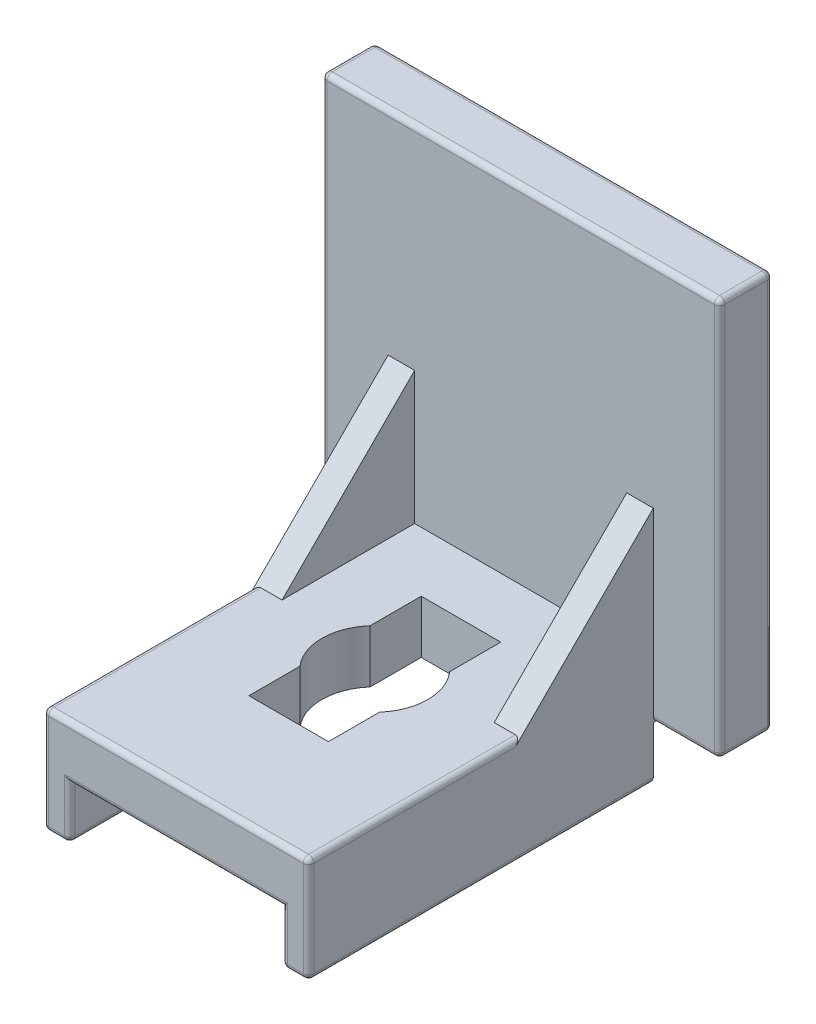
from build123d import *

# Parameters (mm, degrees)
SKETCH_1_W           = 15
SKETCH_1_H           = 15
EXTRUDE_1_DEPTH      = 2
EXTRUDE_2_DEPTH      = 2
SKETCH_3_W           = 1
SKETCH_3_H           = 13
EXTRUDE_3_DEPTH      = 2
CUT_EXTRUDE_1_REACH  = 24.5
EXTRUDE_START        = 4
EXTRUDE_4_DEPTH      = 1
EXTRUDE_START_2      = -4
EXTRUDE_5_DEPTH      = 1
SKETCH_6_W           = 3
SKETCH_6_H           = 3
EXTRUDE_6_DEPTH      = 1
EXTRUDE_7_DEPTH      = 1
EXTRUDE_7_DEPTH_BACK = 4
CUT_EXTRUDE_2_REACH  = 25.223
FILLET_1_R           = 0.1
FILLET_4_R           = 0.2
FILLET_5_R           = 0.2
FILLET_6_R           = 0.2


with BuildPart() as part:
    # 草图1 → 凸台-拉伸1 (new body)
    with BuildSketch(Plane.XY):
        with Locations((0, 7.5)):
            Rectangle(SKETCH_1_W, SKETCH_1_H)
    extrude(amount=EXTRUDE_1_DEPTH)

    # 草图2 → 凸台-拉伸2 (add)
    with BuildSketch(Plane(origin=(0, 0, 0), x_dir=(-1, 0, 0), z_dir=(0, -1, 0))):
        Polygon((-4, -2), (-5, -2), (-5, -15), (5, -15), (5, -2), (7.5, -2), (7.5, 0), (-4, 0), align=None)
    extrude(amount=-EXTRUDE_2_DEPTH)

    # 草图3 → 凸台-拉伸3 (add)
    with BuildSketch(Plane(origin=(0, 0, 0), x_dir=(-1, 0, 0), z_dir=(0, -1, 0))):
        with Locations((4.5, -8.5)):
            Rectangle(SKETCH_3_W, SKETCH_3_H)
        with Locations((-4.5, -8.5)):
            Rectangle(SKETCH_3_W, SKETCH_3_H)
    extrude(amount=EXTRUDE_3_DEPTH)

    # 草图4 → 切除-拉伸1 (cut, up to next)
    with BuildSketch(Plane(origin=(0, 0, 0), x_dir=(-1, 0, 0), z_dir=(0, -1, 0)), mode=Mode.PRIVATE) as cut_extrude_1_sk1:
        with BuildLine():
            Line((1.5, -8.822875656), (1.5, -10.75))
            Line((1.5, -10.75), (-1.5, -10.75))
            Line((-1.5, -10.75), (-1.5, -8.822875656))
            ThreePointArc((-1.5, -8.822875656), (-2, -7.5), (-1.5, -6.177124344))
            Line((-1.5, -6.177124344), (-1.5, -4.25))
            Line((-1.5, -4.25), (1.5, -4.25))
            Line((1.5, -4.25), (1.5, -6.177124344))
            ThreePointArc((1.5, -6.177124344), (2, -7.5), (1.5, -8.822875656))
        make_face()
    cut_extrude_1_tool1 = extrude(cut_extrude_1_sk1.sketch, amount=-CUT_EXTRUDE_1_REACH, mode=Mode.PRIVATE) & part.part
    add(cut_extrude_1_tool1.solids().sort_by_distance((0, 0, 7.5))[0], mode=Mode.SUBTRACT)

    # 草图5 → 凸台-拉伸4 (add)
    with BuildSketch(Plane(origin=(0, 0, 0), x_dir=(0, 0, -1), z_dir=(1, 0, 0)).offset(EXTRUDE_START)):
        Polygon((-2, 2), (-7, 2), (-2, 7), align=None)
    extrude(amount=EXTRUDE_4_DEPTH)

    # 草图5<2> → 凸台-拉伸5 (add)
    with BuildSketch(Plane(origin=(0, 0, 0), x_dir=(0, 0, -1), z_dir=(1, 0, 0)).offset(EXTRUDE_START_2)):
        Polygon((-2, 2), (-7, 2), (-2, 7), align=None)
    extrude(amount=-EXTRUDE_5_DEPTH)

    # 草图6 → 凸台-拉伸6 (add)
    with BuildSketch(Plane(origin=(0, 0, 0), x_dir=(-1, 0, 0), z_dir=(0, 0, -1))):
        with Locations((0, 7.5)):
            Rectangle(SKETCH_6_W, SKETCH_6_H)
    extrude(amount=EXTRUDE_6_DEPTH)

    # 草图7 → 凸台-拉伸7 (add, two sides: drawn at the far end of the back side and taken through both)
    with BuildSketch(Plane(origin=(0, 9, 0), x_dir=(1, 0, 0), z_dir=(0, 1, 0)).offset(-EXTRUDE_7_DEPTH_BACK)):
        with BuildLine():
            Line((-1.95, 2.5), (1.95, 2.5))
            Line((1.95, 2.5), (1.95, 1.555590279))
            ThreePointArc((1.95, 1.555590279), (1.780042303, 1.088161527), (1.5, 0.677124344))
            Line((1.5, 0.677124344), (-1.5, 0.677124344))
            ThreePointArc((-1.5, 0.677124344), (-1.780042303, 1.088161527), (-1.95, 1.555590279))
            Line((-1.95, 1.555590279), (-1.95, 2.5))
        make_face()
    extrude(amount=EXTRUDE_7_DEPTH + EXTRUDE_7_DEPTH_BACK)

    # 草图8 → 切除-拉伸2 (cut, up to next)
    with BuildSketch(Plane.ZY.offset(1.95), mode=Mode.PRIVATE) as cut_extrude_2_sk1:
        with BuildLine():
            Line((-2.5, 9.45), (-1.555590279, 9.45))
            ThreePointArc((-1.555590279, 9.45), (-1.088161527, 9.280042303), (-0.677124344, 9))
            Line((-0.677124344, 9), (-0.677124344, 10))
            Line((-0.677124344, 10), (-2.5, 10))
            Line((-2.5, 10), (-2.5, 9.45))
        make_face()
    cut_extrude_2_tool1 = extrude(cut_extrude_2_sk1.sketch, amount=-CUT_EXTRUDE_2_REACH, mode=Mode.PRIVATE) & part.part
    # 草图8 → 切除-拉伸2 (cut, up to next)
    with BuildSketch(Plane.ZY.offset(1.95), mode=Mode.PRIVATE) as cut_extrude_2_sk2:
        with BuildLine():
            Line((-2.5, 5.55), (-2.5, 5))
            Line((-2.5, 5), (-0.677124344, 5))
            Line((-0.677124344, 5), (-0.677124344, 6))
            ThreePointArc((-0.677124344, 6), (-1.088161527, 5.719957697), (-1.555590279, 5.55))
            Line((-1.555590279, 5.55), (-2.5, 5.55))
        make_face()
    cut_extrude_2_tool2 = extrude(cut_extrude_2_sk2.sketch, amount=-CUT_EXTRUDE_2_REACH, mode=Mode.PRIVATE) & part.part
    add(cut_extrude_2_tool1.solids().sort_by_distance((-1.95, 9.669375, -1.500125))[0], mode=Mode.SUBTRACT)
    add(cut_extrude_2_tool2.solids().sort_by_distance((-1.95, 5.330625, -1.500125))[0], mode=Mode.SUBTRACT)

    # 圆角1
    fillet_1_edges = [part.edges().sort_by_distance(p)[0] for p in [
        (0, 9.45, -2.5),
        (1.95, 7.5, -2.5),
        (-1.95, 7.5, -2.5),
        (0, 5.55, -2.5),
    ]]
    fillet(fillet_1_edges, radius=FILLET_1_R)

    # 圆角4
    fillet_4_edges = [part.edges().sort_by_distance(p)[0] for p in [
        (7.5, 7.5, 2),
        (0, 15, 2),
        (-7.5, 7.5, 2),
        (0, 15, 0),
        (7.5, 7.5, 0),
        (-7.5, 7.5, 0),
        (-7.5, 15, 1),
        (7.5, 15, 1),
        (7.5, 0, 1),
        (-7.5, 0, 1),
    ]]
    fillet(fillet_4_edges, radius=FILLET_4_R)

    # 圆角5
    # the kernel refuses this fillet: 0.2 mm, written as the material it takes off along each edge
    with BuildSketch(Plane(origin=(7.3, 0.2, 1.8), x_dir=(0, 0, 1), z_dir=(0, -1, 0))) as fillet_5_piece_1_section:
        Polygon((0, 0), (FILLET_5_R * 1.02, 0), (FILLET_5_R * 1.02, -FILLET_5_R * 1.02), (0, -FILLET_5_R * 1.02), align=None)
    fillet_5_piece_1 = extrude(amount=FILLET_5_R * 1.02, mode=Mode.PRIVATE)
    fillet_5_piece_1 = fillet_5_piece_1 - Plane(origin=(7.3, 0.2, 1.8), x_dir=(-0.7071067811865475, 0, -0.7071067811865475), z_dir=(0, -1, 0)) * Sphere(FILLET_5_R, mode=Mode.PRIVATE)
    add(fillet_5_piece_1, mode=Mode.SUBTRACT)
    with BuildSketch(Plane(origin=(7.3, 0.2, 0.2), x_dir=(0, -1, 0), z_dir=(0, 0, -1))) as fillet_5_piece_2_section:
        Polygon((0, 0), (FILLET_5_R * 1.02, 0), (FILLET_5_R * 1.02, -FILLET_5_R * 1.02), (0, -FILLET_5_R * 1.02), align=None)
    fillet_5_piece_2 = extrude(amount=FILLET_5_R * 1.02, mode=Mode.PRIVATE)
    fillet_5_piece_2 = fillet_5_piece_2 - Plane(origin=(7.3, 0.2, 0.2), x_dir=(-0.7071067811865475, 0.7071067811865475, 0), z_dir=(0, 0, -1)) * Sphere(FILLET_5_R, mode=Mode.PRIVATE)
    add(fillet_5_piece_2, mode=Mode.SUBTRACT)
    with BuildSketch(Plane(origin=(-7.3, 0.2, 1.8), x_dir=(0, 0, 1), z_dir=(0, -1, 0))) as fillet_5_piece_3_section:
        Polygon((0, 0), (FILLET_5_R * 1.02, 0), (FILLET_5_R * 1.02, FILLET_5_R * 1.02), (0, FILLET_5_R * 1.02), align=None)
    fillet_5_piece_3 = extrude(amount=FILLET_5_R * 1.02, mode=Mode.PRIVATE)
    fillet_5_piece_3 = fillet_5_piece_3 - Plane(origin=(-7.3, 0.2, 1.8), x_dir=(0.7071067811865475, 0, -0.7071067811865475), z_dir=(0, -1, 0)) * Sphere(FILLET_5_R, mode=Mode.PRIVATE)
    add(fillet_5_piece_3, mode=Mode.SUBTRACT)
    with BuildSketch(Plane(origin=(-7.3, 0.2, 0.2), x_dir=(0, -1, 0), z_dir=(0, 0, -1))) as fillet_5_piece_4_section:
        Polygon((0, 0), (FILLET_5_R * 1.02, 0), (FILLET_5_R * 1.02, FILLET_5_R * 1.02), (0, FILLET_5_R * 1.02), align=None)
    fillet_5_piece_4 = extrude(amount=FILLET_5_R * 1.02, mode=Mode.PRIVATE)
    fillet_5_piece_4 = fillet_5_piece_4 - Plane(origin=(-7.3, 0.2, 0.2), x_dir=(0.7071067811865475, 0.7071067811865475, 0), z_dir=(0, 0, -1)) * Sphere(FILLET_5_R, mode=Mode.PRIVATE)
    add(fillet_5_piece_4, mode=Mode.SUBTRACT)
    with BuildSketch(Plane(origin=(5, 0, 2), x_dir=(0, 0, -1), z_dir=(1, 0, 0))) as fillet_5_piece_5_section:
        with BuildLine():
            CenterArc((FILLET_5_R, FILLET_5_R), FILLET_5_R, 180, 90)
            Line((0, FILLET_5_R), (-FILLET_5_R * 0.02, FILLET_5_R))
            Line((-FILLET_5_R * 0.02, FILLET_5_R), (-FILLET_5_R * 0.02, -FILLET_5_R * 0.02))
            Line((-FILLET_5_R * 0.02, -FILLET_5_R * 0.02), (FILLET_5_R, -FILLET_5_R * 0.02))
            Line((FILLET_5_R, -FILLET_5_R * 0.02), (FILLET_5_R, 0))
        make_face()
    fillet_5_piece_5 = extrude(amount=2.3, mode=Mode.PRIVATE)
    fillet_5_piece_5 = split(fillet_5_piece_5, bisect_by=Plane(origin=(6.15, 0.040694626, 2), z_dir=(0, 0, -1)), keep=Keep.TOP, mode=Mode.PRIVATE)
    add(fillet_5_piece_5, mode=Mode.SUBTRACT)
    with BuildSketch(Plane(origin=(-7.3, 0, 0), x_dir=(0, 1, 0), z_dir=(1, 0, 0))) as fillet_5_piece_6:
        with BuildLine():
            CenterArc((FILLET_5_R, FILLET_5_R), FILLET_5_R, 180, 90)
            Line((0, FILLET_5_R), (-FILLET_5_R * 0.02, FILLET_5_R))
            Line((-FILLET_5_R * 0.02, FILLET_5_R), (-FILLET_5_R * 0.02, -FILLET_5_R * 0.02))
            Line((-FILLET_5_R * 0.02, -FILLET_5_R * 0.02), (FILLET_5_R, -FILLET_5_R * 0.02))
            Line((FILLET_5_R, -FILLET_5_R * 0.02), (FILLET_5_R, 0))
        make_face()
    extrude(amount=14.6, mode=Mode.SUBTRACT)
    with BuildSketch(Plane(origin=(-7.3, 0, 2), x_dir=(0, 0, -1), z_dir=(1, 0, 0))) as fillet_5_piece_7_section:
        with BuildLine():
            CenterArc((FILLET_5_R, FILLET_5_R), FILLET_5_R, 180, 90)
            Line((0, FILLET_5_R), (-FILLET_5_R * 0.02, FILLET_5_R))
            Line((-FILLET_5_R * 0.02, FILLET_5_R), (-FILLET_5_R * 0.02, -FILLET_5_R * 0.02))
            Line((-FILLET_5_R * 0.02, -FILLET_5_R * 0.02), (FILLET_5_R, -FILLET_5_R * 0.02))
            Line((FILLET_5_R, -FILLET_5_R * 0.02), (FILLET_5_R, 0))
        make_face()
    fillet_5_piece_7 = extrude(amount=2.3, mode=Mode.PRIVATE)
    fillet_5_piece_7 = split(fillet_5_piece_7, bisect_by=Plane(origin=(-6.15, 0.040694626, 2), z_dir=(0, 0, -1)), keep=Keep.TOP, mode=Mode.PRIVATE)
    add(fillet_5_piece_7, mode=Mode.SUBTRACT)
    with BuildSketch(Plane(origin=(5, 2, 15), x_dir=(0, -1, 0), z_dir=(-1, 0, 0))) as fillet_5_piece_8:
        with BuildLine():
            CenterArc((FILLET_5_R, -FILLET_5_R), FILLET_5_R, 90, 90)
            Line((0, -FILLET_5_R), (-FILLET_5_R * 0.02, -FILLET_5_R))
            Line((-FILLET_5_R * 0.02, -FILLET_5_R), (-FILLET_5_R * 0.02, FILLET_5_R * 0.02))
            Line((-FILLET_5_R * 0.02, FILLET_5_R * 0.02), (FILLET_5_R, FILLET_5_R * 0.02))
            Line((FILLET_5_R, FILLET_5_R * 0.02), (FILLET_5_R, 0))
        make_face()
    extrude(amount=10, mode=Mode.SUBTRACT)
    with BuildSketch(Plane(origin=(-5, 2, 15), x_dir=(1, 0, 0), z_dir=(0, -1, 0)), Plane(origin=(5, -2, 15), x_dir=(-1, 0, 0), z_dir=(0, 1, 0))) as fillet_5_piece_9:
        with BuildLine():
            CenterArc((FILLET_5_R, -FILLET_5_R), FILLET_5_R, 90, 90)
            Line((0, -FILLET_5_R), (-FILLET_5_R * 0.02, -FILLET_5_R))
            Line((-FILLET_5_R * 0.02, -FILLET_5_R), (-FILLET_5_R * 0.02, FILLET_5_R * 0.02))
            Line((-FILLET_5_R * 0.02, FILLET_5_R * 0.02), (FILLET_5_R, FILLET_5_R * 0.02))
            Line((FILLET_5_R, FILLET_5_R * 0.02), (FILLET_5_R, 0))
        make_face()
    extrude(amount=4, mode=Mode.SUBTRACT)
    with BuildSketch(Plane(origin=(-4, 0, 15), x_dir=(0, 0, -1), z_dir=(0, -1, 0))) as fillet_5_piece_10:
        with BuildLine():
            CenterArc((FILLET_5_R, -FILLET_5_R), FILLET_5_R, 90, 90)
            Line((0, -FILLET_5_R), (-FILLET_5_R * 0.02, -FILLET_5_R))
            Line((-FILLET_5_R * 0.02, -FILLET_5_R), (-FILLET_5_R * 0.02, FILLET_5_R * 0.02))
            Line((-FILLET_5_R * 0.02, FILLET_5_R * 0.02), (FILLET_5_R, FILLET_5_R * 0.02))
            Line((FILLET_5_R, FILLET_5_R * 0.02), (FILLET_5_R, 0))
        make_face()
    extrude(amount=2, mode=Mode.SUBTRACT)
    with BuildSketch(Plane(origin=(-4, -2, 15), x_dir=(0, 1, 0), z_dir=(-1, 0, 0))) as fillet_5_piece_11:
        with BuildLine():
            CenterArc((FILLET_5_R, FILLET_5_R), FILLET_5_R, 180, 90)
            Line((0, FILLET_5_R), (-FILLET_5_R * 0.02, FILLET_5_R))
            Line((-FILLET_5_R * 0.02, FILLET_5_R), (-FILLET_5_R * 0.02, -FILLET_5_R * 0.02))
            Line((-FILLET_5_R * 0.02, -FILLET_5_R * 0.02), (FILLET_5_R, -FILLET_5_R * 0.02))
            Line((FILLET_5_R, -FILLET_5_R * 0.02), (FILLET_5_R, 0))
        make_face()
    extrude(amount=1, mode=Mode.SUBTRACT)
    with BuildSketch(Plane(origin=(4, 0, 15), x_dir=(0, 0, -1), z_dir=(-1, 0, 0))) as fillet_5_piece_12:
        with BuildLine():
            CenterArc((FILLET_5_R, -FILLET_5_R), FILLET_5_R, 90, 90)
            Line((0, -FILLET_5_R), (-FILLET_5_R * 0.02, -FILLET_5_R))
            Line((-FILLET_5_R * 0.02, -FILLET_5_R), (-FILLET_5_R * 0.02, FILLET_5_R * 0.02))
            Line((-FILLET_5_R * 0.02, FILLET_5_R * 0.02), (FILLET_5_R, FILLET_5_R * 0.02))
            Line((FILLET_5_R, FILLET_5_R * 0.02), (FILLET_5_R, 0))
        make_face()
    extrude(amount=8, mode=Mode.SUBTRACT)
    with BuildSketch(Plane(origin=(4, 0, 15), x_dir=(0, 0, -1), z_dir=(0, -1, 0))) as fillet_5_piece_13:
        with BuildLine():
            CenterArc((FILLET_5_R, FILLET_5_R), FILLET_5_R, 180, 90)
            Line((0, FILLET_5_R), (-FILLET_5_R * 0.02, FILLET_5_R))
            Line((-FILLET_5_R * 0.02, FILLET_5_R), (-FILLET_5_R * 0.02, -FILLET_5_R * 0.02))
            Line((-FILLET_5_R * 0.02, -FILLET_5_R * 0.02), (FILLET_5_R, -FILLET_5_R * 0.02))
            Line((FILLET_5_R, -FILLET_5_R * 0.02), (FILLET_5_R, 0))
        make_face()
    extrude(amount=2, mode=Mode.SUBTRACT)
    with BuildSketch(Plane(origin=(4, -2, 15), x_dir=(0, 1, 0), z_dir=(1, 0, 0))) as fillet_5_piece_14:
        with BuildLine():
            CenterArc((FILLET_5_R, -FILLET_5_R), FILLET_5_R, 90, 90)
            Line((0, -FILLET_5_R), (-FILLET_5_R * 0.02, -FILLET_5_R))
            Line((-FILLET_5_R * 0.02, -FILLET_5_R), (-FILLET_5_R * 0.02, FILLET_5_R * 0.02))
            Line((-FILLET_5_R * 0.02, FILLET_5_R * 0.02), (FILLET_5_R, FILLET_5_R * 0.02))
            Line((FILLET_5_R, FILLET_5_R * 0.02), (FILLET_5_R, 0))
        make_face()
    extrude(amount=1, mode=Mode.SUBTRACT)
    with BuildSketch(Plane(origin=(5.5, 2, 15), x_dir=(0, -1, 0), z_dir=(-1, 0, 0))) as fillet_5_piece_15a_section:
        with BuildLine():
            CenterArc((FILLET_5_R, -FILLET_5_R), FILLET_5_R, 90, 90)
            Line((0, -FILLET_5_R), (-FILLET_5_R * 0.02, -FILLET_5_R))
            Line((-FILLET_5_R * 0.02, -FILLET_5_R), (-FILLET_5_R * 0.02, FILLET_5_R * 0.02))
            Line((-FILLET_5_R * 0.02, FILLET_5_R * 0.02), (FILLET_5_R, FILLET_5_R * 0.02))
            Line((FILLET_5_R, FILLET_5_R * 0.02), (FILLET_5_R, 0))
        make_face()
    fillet_5_piece_15a = extrude(amount=10.5, mode=Mode.PRIVATE)
    fillet_5_piece_15a = split(fillet_5_piece_15a, bisect_by=Plane(origin=(5, 1.954720977, 14.954720977), z_dir=(1, 0, 0)), keep=Keep.TOP, mode=Mode.PRIVATE)
    with BuildSketch(Plane(origin=(5, -2, 15), x_dir=(-1, 0, 0), z_dir=(0, 1, 0))) as fillet_5_piece_15b_section:
        with BuildLine():
            CenterArc((FILLET_5_R, -FILLET_5_R), FILLET_5_R, 90, 90)
            Line((0, -FILLET_5_R), (-FILLET_5_R * 0.02, -FILLET_5_R))
            Line((-FILLET_5_R * 0.02, -FILLET_5_R), (-FILLET_5_R * 0.02, FILLET_5_R * 0.02))
            Line((-FILLET_5_R * 0.02, FILLET_5_R * 0.02), (FILLET_5_R, FILLET_5_R * 0.02))
            Line((FILLET_5_R, FILLET_5_R * 0.02), (FILLET_5_R, 0))
        make_face()
    fillet_5_piece_15b = extrude(amount=4.5, mode=Mode.PRIVATE)
    fillet_5_piece_15b = split(fillet_5_piece_15b, bisect_by=Plane(origin=(4.954720977, 2, 14.954720977), z_dir=(0, 1, 0)), keep=Keep.TOP, mode=Mode.PRIVATE)
    fillet_5_piece_15 = fillet_5_piece_15a & fillet_5_piece_15b
    add(fillet_5_piece_15, mode=Mode.SUBTRACT)
    with BuildSketch(Plane(origin=(5, 2, 15), x_dir=(0, -1, 0), z_dir=(-1, 0, 0))) as fillet_5_piece_16a_section:
        with BuildLine():
            CenterArc((FILLET_5_R, -FILLET_5_R), FILLET_5_R, 90, 90)
            Line((0, -FILLET_5_R), (-FILLET_5_R * 0.02, -FILLET_5_R))
            Line((-FILLET_5_R * 0.02, -FILLET_5_R), (-FILLET_5_R * 0.02, FILLET_5_R * 0.02))
            Line((-FILLET_5_R * 0.02, FILLET_5_R * 0.02), (FILLET_5_R, FILLET_5_R * 0.02))
            Line((FILLET_5_R, FILLET_5_R * 0.02), (FILLET_5_R, 0))
        make_face()
    fillet_5_piece_16a = extrude(amount=10.5, mode=Mode.PRIVATE)
    fillet_5_piece_16a = split(fillet_5_piece_16a, bisect_by=Plane(origin=(-5, 1.954720977, 14.954720977), z_dir=(-1, 0, 0)), keep=Keep.TOP, mode=Mode.PRIVATE)
    with BuildSketch(Plane(origin=(-5, 2.5, 15), x_dir=(1, 0, 0), z_dir=(0, -1, 0))) as fillet_5_piece_16b_section:
        with BuildLine():
            CenterArc((FILLET_5_R, -FILLET_5_R), FILLET_5_R, 90, 90)
            Line((0, -FILLET_5_R), (-FILLET_5_R * 0.02, -FILLET_5_R))
            Line((-FILLET_5_R * 0.02, -FILLET_5_R), (-FILLET_5_R * 0.02, FILLET_5_R * 0.02))
            Line((-FILLET_5_R * 0.02, FILLET_5_R * 0.02), (FILLET_5_R, FILLET_5_R * 0.02))
            Line((FILLET_5_R, FILLET_5_R * 0.02), (FILLET_5_R, 0))
        make_face()
    fillet_5_piece_16b = extrude(amount=4.5, mode=Mode.PRIVATE)
    fillet_5_piece_16b = split(fillet_5_piece_16b, bisect_by=Plane(origin=(-4.954720977, 2, 14.954720977), z_dir=(0, 1, 0)), keep=Keep.TOP, mode=Mode.PRIVATE)
    fillet_5_piece_16 = fillet_5_piece_16a & fillet_5_piece_16b
    add(fillet_5_piece_16, mode=Mode.SUBTRACT)
    with BuildSketch(Plane(origin=(-5, 2, 15), x_dir=(1, 0, 0), z_dir=(0, -1, 0))) as fillet_5_piece_17a_section:
        with BuildLine():
            CenterArc((FILLET_5_R, -FILLET_5_R), FILLET_5_R, 90, 90)
            Line((0, -FILLET_5_R), (-FILLET_5_R * 0.02, -FILLET_5_R))
            Line((-FILLET_5_R * 0.02, -FILLET_5_R), (-FILLET_5_R * 0.02, FILLET_5_R * 0.02))
            Line((-FILLET_5_R * 0.02, FILLET_5_R * 0.02), (FILLET_5_R, FILLET_5_R * 0.02))
            Line((FILLET_5_R, FILLET_5_R * 0.02), (FILLET_5_R, 0))
        make_face()
    fillet_5_piece_17a = extrude(amount=4.5, mode=Mode.PRIVATE)
    fillet_5_piece_17a = split(fillet_5_piece_17a, bisect_by=Plane(origin=(-4.954720977, -2, 14.954720977), z_dir=(0, -1, 0)), keep=Keep.TOP, mode=Mode.PRIVATE)
    with BuildSketch(Plane(origin=(-4, -2, 15), x_dir=(0, 1, 0), z_dir=(-1, 0, 0))) as fillet_5_piece_17b_section:
        with BuildLine():
            CenterArc((FILLET_5_R, FILLET_5_R), FILLET_5_R, 180, 90)
            Line((0, FILLET_5_R), (-FILLET_5_R * 0.02, FILLET_5_R))
            Line((-FILLET_5_R * 0.02, FILLET_5_R), (-FILLET_5_R * 0.02, -FILLET_5_R * 0.02))
            Line((-FILLET_5_R * 0.02, -FILLET_5_R * 0.02), (FILLET_5_R, -FILLET_5_R * 0.02))
            Line((FILLET_5_R, -FILLET_5_R * 0.02), (FILLET_5_R, 0))
        make_face()
    fillet_5_piece_17b = extrude(amount=1.5, mode=Mode.PRIVATE)
    fillet_5_piece_17b = split(fillet_5_piece_17b, bisect_by=Plane(origin=(-5, -1.954720977, 14.954720977), z_dir=(-1, 0, 0)), keep=Keep.TOP, mode=Mode.PRIVATE)
    fillet_5_piece_17 = fillet_5_piece_17a & fillet_5_piece_17b
    add(fillet_5_piece_17, mode=Mode.SUBTRACT)
    with BuildSketch(Plane(origin=(4, -2, 15), x_dir=(0, 1, 0), z_dir=(1, 0, 0))) as fillet_5_piece_18a_section:
        with BuildLine():
            CenterArc((FILLET_5_R, -FILLET_5_R), FILLET_5_R, 90, 90)
            Line((0, -FILLET_5_R), (-FILLET_5_R * 0.02, -FILLET_5_R))
            Line((-FILLET_5_R * 0.02, -FILLET_5_R), (-FILLET_5_R * 0.02, FILLET_5_R * 0.02))
            Line((-FILLET_5_R * 0.02, FILLET_5_R * 0.02), (FILLET_5_R, FILLET_5_R * 0.02))
            Line((FILLET_5_R, FILLET_5_R * 0.02), (FILLET_5_R, 0))
        make_face()
    fillet_5_piece_18a = extrude(amount=1.5, mode=Mode.PRIVATE)
    fillet_5_piece_18a = split(fillet_5_piece_18a, bisect_by=Plane(origin=(5, -1.954720977, 14.954720977), z_dir=(1, 0, 0)), keep=Keep.TOP, mode=Mode.PRIVATE)
    with BuildSketch(Plane(origin=(5, -2.5, 15), x_dir=(-1, 0, 0), z_dir=(0, 1, 0))) as fillet_5_piece_18b_section:
        with BuildLine():
            CenterArc((FILLET_5_R, -FILLET_5_R), FILLET_5_R, 90, 90)
            Line((0, -FILLET_5_R), (-FILLET_5_R * 0.02, -FILLET_5_R))
            Line((-FILLET_5_R * 0.02, -FILLET_5_R), (-FILLET_5_R * 0.02, FILLET_5_R * 0.02))
            Line((-FILLET_5_R * 0.02, FILLET_5_R * 0.02), (FILLET_5_R, FILLET_5_R * 0.02))
            Line((FILLET_5_R, FILLET_5_R * 0.02), (FILLET_5_R, 0))
        make_face()
    fillet_5_piece_18b = extrude(amount=4.5, mode=Mode.PRIVATE)
    fillet_5_piece_18b = split(fillet_5_piece_18b, bisect_by=Plane(origin=(4.954720977, -2, 14.954720977), z_dir=(0, -1, 0)), keep=Keep.TOP, mode=Mode.PRIVATE)
    fillet_5_piece_18 = fillet_5_piece_18a & fillet_5_piece_18b
    add(fillet_5_piece_18, mode=Mode.SUBTRACT)
    with BuildSketch(Plane(origin=(4, 0, 15), x_dir=(0, 0, -1), z_dir=(-1, 0, 0))) as fillet_5_piece_19a_section:
        with BuildLine():
            CenterArc((FILLET_5_R, -FILLET_5_R), FILLET_5_R, 90, 90)
            Line((0, -FILLET_5_R), (-FILLET_5_R * 0.02, -FILLET_5_R))
            Line((-FILLET_5_R * 0.02, -FILLET_5_R), (-FILLET_5_R * 0.02, FILLET_5_R * 0.02))
            Line((-FILLET_5_R * 0.02, FILLET_5_R * 0.02), (FILLET_5_R, FILLET_5_R * 0.02))
            Line((FILLET_5_R, FILLET_5_R * 0.02), (FILLET_5_R, 0))
        make_face()
    fillet_5_piece_19a = extrude(amount=8.5, mode=Mode.PRIVATE)
    fillet_5_piece_19a = split(fillet_5_piece_19a, bisect_by=Plane(origin=(-4, 0.045279023, 14.954720977), z_dir=(-1, 0, 0)), keep=Keep.TOP, mode=Mode.PRIVATE)
    with BuildSketch(Plane(origin=(-4, 0.5, 15), x_dir=(0, 0, -1), z_dir=(0, -1, 0))) as fillet_5_piece_19b_section:
        with BuildLine():
            CenterArc((FILLET_5_R, -FILLET_5_R), FILLET_5_R, 90, 90)
            Line((0, -FILLET_5_R), (-FILLET_5_R * 0.02, -FILLET_5_R))
            Line((-FILLET_5_R * 0.02, -FILLET_5_R), (-FILLET_5_R * 0.02, FILLET_5_R * 0.02))
            Line((-FILLET_5_R * 0.02, FILLET_5_R * 0.02), (FILLET_5_R, FILLET_5_R * 0.02))
            Line((FILLET_5_R, FILLET_5_R * 0.02), (FILLET_5_R, 0))
        make_face()
    fillet_5_piece_19b = extrude(amount=2.5, mode=Mode.PRIVATE)
    fillet_5_piece_19b = split(fillet_5_piece_19b, bisect_by=Plane(origin=(-4.045279023, 0, 14.954720977), z_dir=(0, 1, 0)), keep=Keep.TOP, mode=Mode.PRIVATE)
    fillet_5_piece_19 = fillet_5_piece_19a & fillet_5_piece_19b
    add(fillet_5_piece_19, mode=Mode.SUBTRACT)
    with BuildSketch(Plane(origin=(-4, 0, 15), x_dir=(0, 0, -1), z_dir=(0, -1, 0))) as fillet_5_piece_20a_section:
        with BuildLine():
            CenterArc((FILLET_5_R, -FILLET_5_R), FILLET_5_R, 90, 90)
            Line((0, -FILLET_5_R), (-FILLET_5_R * 0.02, -FILLET_5_R))
            Line((-FILLET_5_R * 0.02, -FILLET_5_R), (-FILLET_5_R * 0.02, FILLET_5_R * 0.02))
            Line((-FILLET_5_R * 0.02, FILLET_5_R * 0.02), (FILLET_5_R, FILLET_5_R * 0.02))
            Line((FILLET_5_R, FILLET_5_R * 0.02), (FILLET_5_R, 0))
        make_face()
    fillet_5_piece_20a = extrude(amount=2.5, mode=Mode.PRIVATE)
    fillet_5_piece_20a = split(fillet_5_piece_20a, bisect_by=Plane(origin=(-4.045279023, -2, 14.954720977), z_dir=(0, -1, 0)), keep=Keep.TOP, mode=Mode.PRIVATE)
    with BuildSketch(Plane(origin=(-3.5, -2, 15), x_dir=(0, 1, 0), z_dir=(-1, 0, 0))) as fillet_5_piece_20b_section:
        with BuildLine():
            CenterArc((FILLET_5_R, FILLET_5_R), FILLET_5_R, 180, 90)
            Line((0, FILLET_5_R), (-FILLET_5_R * 0.02, FILLET_5_R))
            Line((-FILLET_5_R * 0.02, FILLET_5_R), (-FILLET_5_R * 0.02, -FILLET_5_R * 0.02))
            Line((-FILLET_5_R * 0.02, -FILLET_5_R * 0.02), (FILLET_5_R, -FILLET_5_R * 0.02))
            Line((FILLET_5_R, -FILLET_5_R * 0.02), (FILLET_5_R, 0))
        make_face()
    fillet_5_piece_20b = extrude(amount=1.5, mode=Mode.PRIVATE)
    fillet_5_piece_20b = split(fillet_5_piece_20b, bisect_by=Plane(origin=(-4, -1.954720977, 14.954720977), z_dir=(1, 0, 0)), keep=Keep.TOP, mode=Mode.PRIVATE)
    fillet_5_piece_20 = fillet_5_piece_20a & fillet_5_piece_20b
    add(fillet_5_piece_20, mode=Mode.SUBTRACT)
    with BuildSketch(Plane(origin=(4.5, 0, 15), x_dir=(0, 0, -1), z_dir=(-1, 0, 0))) as fillet_5_piece_21a_section:
        with BuildLine():
            CenterArc((FILLET_5_R, -FILLET_5_R), FILLET_5_R, 90, 90)
            Line((0, -FILLET_5_R), (-FILLET_5_R * 0.02, -FILLET_5_R))
            Line((-FILLET_5_R * 0.02, -FILLET_5_R), (-FILLET_5_R * 0.02, FILLET_5_R * 0.02))
            Line((-FILLET_5_R * 0.02, FILLET_5_R * 0.02), (FILLET_5_R, FILLET_5_R * 0.02))
            Line((FILLET_5_R, FILLET_5_R * 0.02), (FILLET_5_R, 0))
        make_face()
    fillet_5_piece_21a = extrude(amount=8.5, mode=Mode.PRIVATE)
    fillet_5_piece_21a = split(fillet_5_piece_21a, bisect_by=Plane(origin=(4, 0.045279023, 14.954720977), z_dir=(1, 0, 0)), keep=Keep.TOP, mode=Mode.PRIVATE)
    with BuildSketch(Plane(origin=(4, 0.5, 15), x_dir=(0, 0, -1), z_dir=(0, -1, 0))) as fillet_5_piece_21b_section:
        with BuildLine():
            CenterArc((FILLET_5_R, FILLET_5_R), FILLET_5_R, 180, 90)
            Line((0, FILLET_5_R), (-FILLET_5_R * 0.02, FILLET_5_R))
            Line((-FILLET_5_R * 0.02, FILLET_5_R), (-FILLET_5_R * 0.02, -FILLET_5_R * 0.02))
            Line((-FILLET_5_R * 0.02, -FILLET_5_R * 0.02), (FILLET_5_R, -FILLET_5_R * 0.02))
            Line((FILLET_5_R, -FILLET_5_R * 0.02), (FILLET_5_R, 0))
        make_face()
    fillet_5_piece_21b = extrude(amount=2.5, mode=Mode.PRIVATE)
    fillet_5_piece_21b = split(fillet_5_piece_21b, bisect_by=Plane(origin=(4.045279023, 0, 14.954720977), z_dir=(0, 1, 0)), keep=Keep.TOP, mode=Mode.PRIVATE)
    fillet_5_piece_21 = fillet_5_piece_21a & fillet_5_piece_21b
    add(fillet_5_piece_21, mode=Mode.SUBTRACT)
    with BuildSketch(Plane(origin=(4, 0, 15), x_dir=(0, 0, -1), z_dir=(0, -1, 0))) as fillet_5_piece_22a_section:
        with BuildLine():
            CenterArc((FILLET_5_R, FILLET_5_R), FILLET_5_R, 180, 90)
            Line((0, FILLET_5_R), (-FILLET_5_R * 0.02, FILLET_5_R))
            Line((-FILLET_5_R * 0.02, FILLET_5_R), (-FILLET_5_R * 0.02, -FILLET_5_R * 0.02))
            Line((-FILLET_5_R * 0.02, -FILLET_5_R * 0.02), (FILLET_5_R, -FILLET_5_R * 0.02))
            Line((FILLET_5_R, -FILLET_5_R * 0.02), (FILLET_5_R, 0))
        make_face()
    fillet_5_piece_22a = extrude(amount=2.5, mode=Mode.PRIVATE)
    fillet_5_piece_22a = split(fillet_5_piece_22a, bisect_by=Plane(origin=(4.045279023, -2, 14.954720977), z_dir=(0, -1, 0)), keep=Keep.TOP, mode=Mode.PRIVATE)
    with BuildSketch(Plane(origin=(3.5, -2, 15), x_dir=(0, 1, 0), z_dir=(1, 0, 0))) as fillet_5_piece_22b_section:
        with BuildLine():
            CenterArc((FILLET_5_R, -FILLET_5_R), FILLET_5_R, 90, 90)
            Line((0, -FILLET_5_R), (-FILLET_5_R * 0.02, -FILLET_5_R))
            Line((-FILLET_5_R * 0.02, -FILLET_5_R), (-FILLET_5_R * 0.02, FILLET_5_R * 0.02))
            Line((-FILLET_5_R * 0.02, FILLET_5_R * 0.02), (FILLET_5_R, FILLET_5_R * 0.02))
            Line((FILLET_5_R, FILLET_5_R * 0.02), (FILLET_5_R, 0))
        make_face()
    fillet_5_piece_22b = extrude(amount=1.5, mode=Mode.PRIVATE)
    fillet_5_piece_22b = split(fillet_5_piece_22b, bisect_by=Plane(origin=(4, -1.954720977, 14.954720977), z_dir=(-1, 0, 0)), keep=Keep.TOP, mode=Mode.PRIVATE)
    fillet_5_piece_22 = fillet_5_piece_22a & fillet_5_piece_22b
    add(fillet_5_piece_22, mode=Mode.SUBTRACT)

    # 圆角6
    # the kernel refuses this fillet: 0.2 mm, written as the material it takes off along each edge
    with BuildSketch(Plane(origin=(4.8, 1.8, 14.8), x_dir=(0, 1, 0), z_dir=(1, 0, 0))) as fillet_6_piece_1_section:
        Polygon((0, 0), (FILLET_6_R, 0), (FILLET_6_R, FILLET_6_R), (0, FILLET_6_R), align=None)
    fillet_6_piece_1 = extrude(amount=FILLET_6_R, mode=Mode.PRIVATE)
    fillet_6_piece_1 = fillet_6_piece_1 - Plane(origin=(4.8, 1.8, 14.8), x_dir=(0, -0.7071067811865475, -0.7071067811865475), z_dir=(1, 0, 0)) * Sphere(FILLET_6_R, mode=Mode.PRIVATE)
    add(fillet_6_piece_1, mode=Mode.SUBTRACT)
    with BuildSketch(Plane(origin=(4.8, -1.8, 14.8), x_dir=(0, -1, 0), z_dir=(1, 0, 0))) as fillet_6_piece_2_section:
        Polygon((0, 0), (FILLET_6_R, 0), (FILLET_6_R, -FILLET_6_R), (0, -FILLET_6_R), align=None)
    fillet_6_piece_2 = extrude(amount=FILLET_6_R, mode=Mode.PRIVATE)
    fillet_6_piece_2 = fillet_6_piece_2 - Plane(origin=(4.8, -1.8, 14.8), x_dir=(0, 0.7071067811865475, -0.7071067811865475), z_dir=(1, 0, 0)) * Sphere(FILLET_6_R, mode=Mode.PRIVATE)
    add(fillet_6_piece_2, mode=Mode.SUBTRACT)
    with BuildSketch(Plane(origin=(-4.8, 1.8, 14.8), x_dir=(0, 1, 0), z_dir=(-1, 0, 0))) as fillet_6_piece_3_section:
        Polygon((0, 0), (FILLET_6_R, 0), (FILLET_6_R, -FILLET_6_R), (0, -FILLET_6_R), align=None)
    fillet_6_piece_3 = extrude(amount=FILLET_6_R, mode=Mode.PRIVATE)
    fillet_6_piece_3 = fillet_6_piece_3 - Plane(origin=(-4.8, 1.8, 14.8), x_dir=(0, -0.7071067811865475, -0.7071067811865475), z_dir=(-1, 0, 0)) * Sphere(FILLET_6_R, mode=Mode.PRIVATE)
    add(fillet_6_piece_3, mode=Mode.SUBTRACT)
    with BuildSketch(Plane(origin=(4.2, -1.8, 14.8), x_dir=(-1, 0, 0), z_dir=(0, -1, 0))) as fillet_6_piece_4_section:
        Polygon((0, 0), (FILLET_6_R, 0), (FILLET_6_R, -FILLET_6_R), (0, -FILLET_6_R), align=None)
    fillet_6_piece_4 = extrude(amount=FILLET_6_R, mode=Mode.PRIVATE)
    fillet_6_piece_4 = fillet_6_piece_4 - Plane(origin=(4.2, -1.8, 14.8), x_dir=(0.7071067811865476, 0, -0.7071067811865475), z_dir=(0, -1, 0)) * Sphere(FILLET_6_R, mode=Mode.PRIVATE)
    add(fillet_6_piece_4, mode=Mode.SUBTRACT)
    with BuildSketch(Plane(origin=(-4.8, -1.8, 14.8), x_dir=(0, -1, 0), z_dir=(-1, 0, 0))) as fillet_6_piece_5_section:
        Polygon((0, 0), (FILLET_6_R, 0), (FILLET_6_R, FILLET_6_R), (0, FILLET_6_R), align=None)
    fillet_6_piece_5 = extrude(amount=FILLET_6_R, mode=Mode.PRIVATE)
    fillet_6_piece_5 = fillet_6_piece_5 - Plane(origin=(-4.8, -1.8, 14.8), x_dir=(0, 0.7071067811865475, -0.7071067811865475), z_dir=(-1, 0, 0)) * Sphere(FILLET_6_R, mode=Mode.PRIVATE)
    add(fillet_6_piece_5, mode=Mode.SUBTRACT)
    with BuildSketch(Plane(origin=(-4.2, -1.8, 14.8), x_dir=(0, -1, 0), z_dir=(1, 0, 0))) as fillet_6_piece_6_section:
        Polygon((0, 0), (FILLET_6_R, 0), (FILLET_6_R, -FILLET_6_R), (0, -FILLET_6_R), align=None)
    fillet_6_piece_6 = extrude(amount=FILLET_6_R, mode=Mode.PRIVATE)
    fillet_6_piece_6 = fillet_6_piece_6 - Plane(origin=(-4.2, -1.8, 14.8), x_dir=(0, 0.7071067811865475, -0.7071067811865475), z_dir=(1, 0, 0)) * Sphere(FILLET_6_R, mode=Mode.PRIVATE)
    add(fillet_6_piece_6, mode=Mode.SUBTRACT)
    with BuildSketch(Plane(origin=(-5, -2, 14.8), x_dir=(0, 1, 0), z_dir=(0, 0, -1)), Plane(origin=(4, -2, 1.5), x_dir=(1, 0, 0), z_dir=(0, 0, 1)), Plane(origin=(-4, -2, 1.5), x_dir=(0, 1, 0), z_dir=(0, 0, 1))) as fillet_6_piece_7:
        with BuildLine():
            CenterArc((FILLET_6_R, FILLET_6_R), FILLET_6_R, 180, 90)
            Line((0, FILLET_6_R), (0, 0))
            Line((0, 0), (FILLET_6_R, 0))
        make_face()
    extrude(amount=13.3, mode=Mode.SUBTRACT)
    with BuildSketch(Plane(origin=(-5, 2, 14.8), x_dir=(0, -1, 0), z_dir=(0, 0, -1))) as fillet_6_piece_8_section:
        with BuildLine():
            CenterArc((FILLET_6_R, -FILLET_6_R), FILLET_6_R, 90, 90)
            Line((0, -FILLET_6_R), (0, 0))
            Line((0, 0), (FILLET_6_R, 0))
        make_face()
    fillet_6_piece_8 = extrude(amount=8.3, mode=Mode.PRIVATE)
    fillet_6_piece_8 = split(fillet_6_piece_8, bisect_by=Plane(origin=(-4.954579351, 0.016220533, 8.983779467), z_dir=(0, 0.7071067811865476, 0.7071067811865476)), keep=Keep.TOP, mode=Mode.PRIVATE)
    add(fillet_6_piece_8, mode=Mode.SUBTRACT)
    with BuildSketch(Plane(origin=(-5.5, -2, 2), x_dir=(0, 1, 0), z_dir=(1, 0, 0))) as fillet_6_piece_9:
        with BuildLine():
            CenterArc((FILLET_6_R, FILLET_6_R), FILLET_6_R, 180, 90)
            Line((0, FILLET_6_R), (0, 0))
            Line((0, 0), (FILLET_6_R, 0))
        make_face()
    extrude(amount=2, mode=Mode.SUBTRACT)
    with BuildSketch(Plane(origin=(5, -2, 14.8), x_dir=(0, 1, 0), z_dir=(0, 0, -1))) as fillet_6_piece_10:
        with BuildLine():
            CenterArc((FILLET_6_R, -FILLET_6_R), FILLET_6_R, 90, 90)
            Line((0, -FILLET_6_R), (0, 0))
            Line((0, 0), (FILLET_6_R, 0))
        make_face()
    extrude(amount=13.3, mode=Mode.SUBTRACT)
    with BuildSketch(Plane(origin=(5.5, -2, 2), x_dir=(0, 1, 0), z_dir=(-1, 0, 0))) as fillet_6_piece_11:
        with BuildLine():
            CenterArc((FILLET_6_R, -FILLET_6_R), FILLET_6_R, 90, 90)
            Line((0, -FILLET_6_R), (0, 0))
            Line((0, 0), (FILLET_6_R, 0))
        make_face()
    extrude(amount=2, mode=Mode.SUBTRACT)
    with BuildSketch(Plane(origin=(5, 2, 6.5), x_dir=(0, -1, 0), z_dir=(0, 0, 1))) as fillet_6_piece_12_section:
        with BuildLine():
            CenterArc((FILLET_6_R, -FILLET_6_R), FILLET_6_R, 90, 90)
            Line((0, -FILLET_6_R), (0, 0))
            Line((0, 0), (FILLET_6_R, 0))
        make_face()
    fillet_6_piece_12 = extrude(amount=8.3, mode=Mode.PRIVATE)
    fillet_6_piece_12 = split(fillet_6_piece_12, bisect_by=Plane(origin=(4.954579351, 0.016220533, 8.983779467), z_dir=(0, 0.7071067811865476, 0.7071067811865476)), keep=Keep.TOP, mode=Mode.PRIVATE)
    add(fillet_6_piece_12, mode=Mode.SUBTRACT)


solid = part.part
